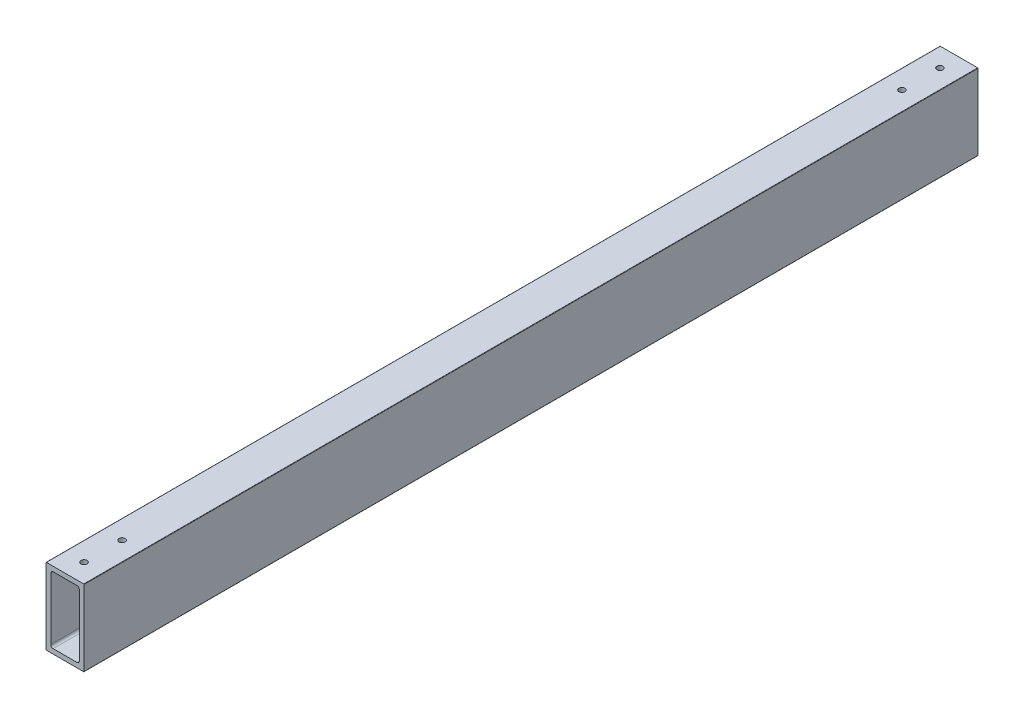
from build123d import *

# Parameters (mm, degrees)
BOSS_EXTRUDE1_DEPTH = 596.9
SKETCH2_R           = 2.032
CUT_EXTRUDE1_DEPTH  = 600.596039013


with BuildPart() as part:
    # Sketch1 → Boss-Extrude1 (new body)
    with BuildSketch(Plane(origin=(0, 0, 0), x_dir=(-1, 0, 0), z_dir=(0, 0, -1))):
        with BuildLine():
            Line((0, 0.254), (0, 50.546))
            ThreePointArc((0, 50.546), (-0.074394878, 50.725605122), (-0.254, 50.8))
            Line((-0.254, 50.8), (-25.146, 50.8))
            ThreePointArc((-25.146, 50.8), (-25.325605122, 50.725605122), (-25.4, 50.546))
            Line((-25.4, 50.546), (-25.4, 0.254))
            ThreePointArc((-25.4, 0.254), (-25.325605122, 0.074394878), (-25.146, 0))
            Line((-25.146, 0), (-0.254, 0))
            ThreePointArc((-0.254, 0), (-0.074394878, 0.074394878), (0, 0.254))
        make_face()
        with BuildLine():
            Line((-3.175, 46.0375), (-3.175, 4.7625))
            ThreePointArc((-3.175, 4.7625), (-3.639967985, 3.639967985), (-4.7625, 3.175))
            Line((-4.7625, 3.175), (-20.6375, 3.175))
            ThreePointArc((-20.6375, 3.175), (-21.760032015, 3.639967985), (-22.225, 4.7625))
            Line((-22.225, 4.7625), (-22.225, 46.0375))
            ThreePointArc((-22.225, 46.0375), (-21.760032015, 47.160032015), (-20.6375, 47.625))
            Line((-20.6375, 47.625), (-4.7625, 47.625))
            ThreePointArc((-4.7625, 47.625), (-3.639967985, 47.160032015), (-3.175, 46.0375))
        make_face(mode=Mode.SUBTRACT)
    extrude(amount=-BOSS_EXTRUDE1_DEPTH)

    # Sketch2 → Cut-Extrude1 (cut, through all)
    with BuildSketch(Plane(origin=(0, 50.8, 0), x_dir=(1, 0, 0), z_dir=(0, 1, 0))):
        with Locations((12.7, -584.2)):
            Circle(SKETCH2_R)
        with Locations((12.7, -558.8)):
            Circle(SKETCH2_R)
        with Locations((12.7, -38.1)):
            Circle(SKETCH2_R)
        with Locations((12.7, -12.7)):
            Circle(SKETCH2_R)
    extrude(amount=-CUT_EXTRUDE1_DEPTH, mode=Mode.SUBTRACT)


solid = part.part
